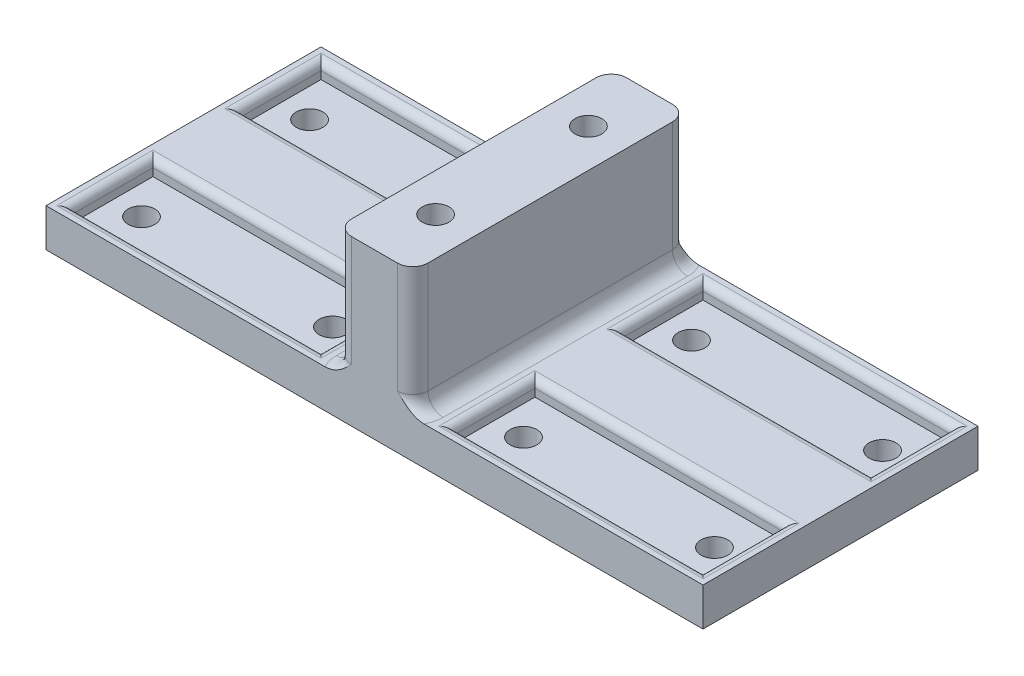
from build123d import *

# Parameters (mm, degrees)
SKETCH_1_W          = 86
SKETCH_1_H          = 36
EXTRUDE_1_DEPTH     = 5
SKETCH_5_W          = 32.6
SKETCH_5_H          = 10.6
SKETCH_5_R          = 1.75
CUT_EXTRUDE_2_DEPTH = 2
SKETCH_5_3_R        = 1.75
CUT_EXTRUDE_3_DEPTH = 47.882832679
FILLET_2_R          = 1
SKETCH_8_W          = 10
SKETCH_8_H          = 36
EXTRUDE_2_DEPTH     = 16.5
SKETCH_9_R          = 1.75
CUT_EXTRUDE_4_DEPTH = 52.334686129
FILLET_3_R          = 2
FILLET_4_R          = 2
SKETCH_10_R         = 4
CUT_EXTRUDE_5_DEPTH = 4


with BuildPart() as part:
    # ｽｹｯﾁ1 → ﾎﾞｽ - 押し出し1 (new body)
    with BuildSketch(Plane(origin=(0, 0, 0), x_dir=(1, 0, 0), z_dir=(0, 1, 0))):
        Rectangle(SKETCH_1_W, SKETCH_1_H)
    extrude(amount=EXTRUDE_1_DEPTH)

    # ｽｹｯﾁ5 → ｶｯﾄ - 押し出し2 (cut)
    # profile 1 of 4: a face of its own
    with BuildSketch(Plane(origin=(0, 5, 0), x_dir=(1, 0, 0), z_dir=(0, 1, 0))):
        with Locations((-25, -11)):
            Rectangle(SKETCH_5_W, SKETCH_5_H)
        with Locations(Location((-37.5, -11, 0), (0, 0, 270))):
            Circle(SKETCH_5_R, mode=Mode.SUBTRACT)
        with Locations(Location((-12.5, -11, 0), (0, 0, 90))):
            Circle(SKETCH_5_R, mode=Mode.SUBTRACT)
    # profile 2 of 4: a face of its own
    with BuildSketch(Plane(origin=(0, 5, 0), x_dir=(1, 0, 0), z_dir=(0, 1, 0))):
        with Locations((-25, 11)):
            Rectangle(SKETCH_5_W, SKETCH_5_H)
        with Locations(Location((-12.5, 11, 0), (0, 0, 270))):
            Circle(SKETCH_5_R, mode=Mode.SUBTRACT)
        with Locations(Location((-37.5, 11, 0), (0, 0, 90))):
            Circle(SKETCH_5_R, mode=Mode.SUBTRACT)
    # profile 3 of 4: a face of its own
    with BuildSketch(Plane(origin=(0, 5, 0), x_dir=(1, 0, 0), z_dir=(0, 1, 0))):
        with Locations((25, 11)):
            Rectangle(SKETCH_5_W, SKETCH_5_H)
        with Locations(Location((37.5, 11, 0), (0, 0, 270))):
            Circle(SKETCH_5_R, mode=Mode.SUBTRACT)
        with Locations(Location((12.5, 11, 0), (0, 0, 90))):
            Circle(SKETCH_5_R, mode=Mode.SUBTRACT)
    # profile 4 of 4: a face of its own
    with BuildSketch(Plane(origin=(0, 5, 0), x_dir=(1, 0, 0), z_dir=(0, 1, 0))):
        with Locations((25, -11)):
            Rectangle(SKETCH_5_W, SKETCH_5_H)
        with Locations(Location((12.5, -11, 0), (0, 0, 270))):
            Circle(SKETCH_5_R, mode=Mode.SUBTRACT)
        with Locations(Location((37.5, -11, 0), (0, 0, 90))):
            Circle(SKETCH_5_R, mode=Mode.SUBTRACT)
    extrude(amount=-CUT_EXTRUDE_2_DEPTH, mode=Mode.SUBTRACT)

    # ｽｹｯﾁ5<3> → ｶｯﾄ - 押し出し3 (cut, through all)
    with BuildSketch(Plane(origin=(0, 5, 0), x_dir=(1, 0, 0), z_dir=(0, 1, 0))):
        with Locations(Location((37.5, -11, 0), (0, 0, 270))):
            Circle(SKETCH_5_3_R)
        with Locations(Location((12.5, -11, 0), (0, 0, 270))):
            Circle(SKETCH_5_3_R)
        with Locations(Location((37.5, 11, 0), (0, 0, 270))):
            Circle(SKETCH_5_3_R)
        with Locations(Location((12.5, 11, 0), (0, 0, 270))):
            Circle(SKETCH_5_3_R)
        with Locations(Location((-12.5, 11, 0), (0, 0, 270))):
            Circle(SKETCH_5_3_R)
        with Locations(Location((-12.5, -11, 0), (0, 0, 270))):
            Circle(SKETCH_5_3_R)
        with Locations(Location((-37.5, -11, 0), (0, 0, 270))):
            Circle(SKETCH_5_3_R)
        with Locations(Location((-37.5, 11, 0), (0, 0, 270))):
            Circle(SKETCH_5_3_R)
    extrude(amount=-CUT_EXTRUDE_3_DEPTH, mode=Mode.SUBTRACT)

    # ﾌｨﾚｯﾄ2
    fillet_2_edges = [part.edges().sort_by_distance(p)[0] for p in [
        (-8.7, 5, 11),
        (-25, 5, 5.7),
        (-41.3, 5, 11),
        (-25, 5, 16.3),
        (-25, 5, -16.3),
        (-41.3, 5, -11),
        (-25, 5, -5.7),
        (-8.7, 5, -11),
        (8.7, 5, -11),
        (25, 5, -5.7),
        (41.3, 5, -11),
        (25, 5, -16.3),
        (25, 5, 16.3),
        (41.3, 5, 11),
        (25, 5, 5.7),
        (8.7, 5, 11),
    ]]
    fillet(fillet_2_edges, radius=FILLET_2_R)

    # ｽｹｯﾁ8 → ﾎﾞｽ - 押し出し2 (add)
    with BuildSketch(Plane(origin=(0, 5, 0), x_dir=(1, 0, 0), z_dir=(0, 1, 0))):
        Rectangle(SKETCH_8_W, SKETCH_8_H)
    extrude(amount=EXTRUDE_2_DEPTH)

    # ｽｹｯﾁ9 → ｶｯﾄ - 押し出し4 (cut, through all)
    with BuildSketch(Plane(origin=(0, 21.5, 0), x_dir=(1, 0, 0), z_dir=(0, 1, 0))):
        with Locations(Location((0, -10, 0), (0, 0, 270))):
            Circle(SKETCH_9_R)
        with Locations(Location((0, 10, 0), (0, 0, 270))):
            Circle(SKETCH_9_R)
    extrude(amount=-CUT_EXTRUDE_4_DEPTH, mode=Mode.SUBTRACT)

    # ﾌｨﾚｯﾄ3
    fillet_3_edges = [part.edges().sort_by_distance(p)[0] for p in [
        (-5, 13.25, -18),
        (-5, 13.25, 18),
        (5, 13.25, 18),
        (5, 13.25, -18),
    ]]
    fillet(fillet_3_edges, radius=FILLET_3_R)

    # ﾌｨﾚｯﾄ4
    # the kernel refuses this fillet: 2 mm, written as the material it adds along each edge
    with BuildSketch(Plane(origin=(5, 5, 16), x_dir=(1, 0, 0), z_dir=(0, 0, -1)), Plane(origin=(-5, 5, -16), x_dir=(-1, 0, 0), z_dir=(0, 0, 1))) as fillet_4_piece_1:
        with BuildLine():
            CenterArc((FILLET_4_R, -FILLET_4_R), FILLET_4_R, 90, 90)
            Line((0, -FILLET_4_R), (0, 0))
            Line((0, 0), (FILLET_4_R, 0))
        make_face()
    extrude(amount=32)
    with BuildSketch(Plane(origin=(3, 5, 16), x_dir=(-0.5976672776328272, 0, -0.8017442392976484), z_dir=(0.8017442392976484, 0, -0.5976672776328272))) as fillet_4_piece_2_section:
        with BuildLine():
            CenterArc((2 + FILLET_4_R, FILLET_4_R), FILLET_4_R, 180, 90)
            Line((2 + FILLET_4_R, 0), (2, 0))
            Line((2, 0), (2, FILLET_4_R))
        make_face()
    fillet_4_piece_2 = revolve(axis=Axis((3, 5, 16), (0, 1, 0)), revolution_arc=233.296989237, mode=Mode.PRIVATE)
    fillet_4_piece_2 = split(fillet_4_piece_2, bisect_by=Plane(origin=(4.499877774, 5.623256904, 18), z_dir=(0, 0, -1)), keep=Keep.TOP, mode=Mode.PRIVATE)
    add(fillet_4_piece_2)
    with BuildSketch(Plane(origin=(-3, 5, 16), x_dir=(0.5976672776328272, 0, -0.8017442392976484), z_dir=(-0.8017442392976484, 0, -0.5976672776328272))) as fillet_4_piece_3_section:
        with BuildLine():
            CenterArc((2 + FILLET_4_R, -FILLET_4_R), FILLET_4_R, 90, 90)
            Line((2, -FILLET_4_R), (2, 0))
            Line((2, 0), (2 + FILLET_4_R, 0))
        make_face()
    fillet_4_piece_3 = revolve(axis=Axis((-3, 5, 16), (0, -1, 0)), revolution_arc=233.296989237, mode=Mode.PRIVATE)
    fillet_4_piece_3 = split(fillet_4_piece_3, bisect_by=Plane(origin=(-4.499877889, 5.623256622, 18), z_dir=(0, 0, -1)), keep=Keep.TOP, mode=Mode.PRIVATE)
    add(fillet_4_piece_3)
    with BuildSketch(Plane(origin=(-3, 5, -16), x_dir=(-1, 0, 0), z_dir=(0, 0, 1))) as fillet_4_piece_4_section:
        with BuildLine():
            CenterArc((2 + FILLET_4_R, -FILLET_4_R), FILLET_4_R, 90, 90)
            Line((2, -FILLET_4_R), (2, 0))
            Line((2, 0), (2 + FILLET_4_R, 0))
        make_face()
    fillet_4_piece_4 = revolve(axis=Axis((-3, 5, -16), (0, -1, 0)), revolution_arc=233.296989237, mode=Mode.PRIVATE)
    fillet_4_piece_4 = split(fillet_4_piece_4, bisect_by=Plane(origin=(-5.439550498, 5.334600403, -18), z_dir=(0, 0, 1)), keep=Keep.TOP, mode=Mode.PRIVATE)
    add(fillet_4_piece_4)
    with BuildSketch(Plane(origin=(3, 5, -16), x_dir=(-0.5976672776328279, 0, 0.8017442392976479), z_dir=(0.8017442392976479, 0, 0.5976672776328279))) as fillet_4_piece_5_section:
        with BuildLine():
            CenterArc((2 + FILLET_4_R, -FILLET_4_R), FILLET_4_R, 90, 90)
            Line((2, -FILLET_4_R), (2, 0))
            Line((2, 0), (2 + FILLET_4_R, 0))
        make_face()
    fillet_4_piece_5 = revolve(axis=Axis((3, 5, -16), (0, -1, 0)), revolution_arc=233.296989237, mode=Mode.PRIVATE)
    fillet_4_piece_5 = split(fillet_4_piece_5, bisect_by=Plane(origin=(4.499877909, 5.62325654, -18), z_dir=(0, 0, 1)), keep=Keep.TOP, mode=Mode.PRIVATE)
    add(fillet_4_piece_5)

    # ｽｹｯﾁ10 → ｶｯﾄ - 押し出し5 (cut)
    with BuildSketch(Plane(origin=(0, 0, 0), x_dir=(-1, 0, 0), z_dir=(0, -1, 0))):
        with Locations(Location((0, -10, 0), (0, 0, 90))):
            Circle(SKETCH_10_R)
        with Locations(Location((0, 10, 0), (0, 0, 90))):
            Circle(SKETCH_10_R)
    extrude(amount=-CUT_EXTRUDE_5_DEPTH, mode=Mode.SUBTRACT)


solid = part.part
